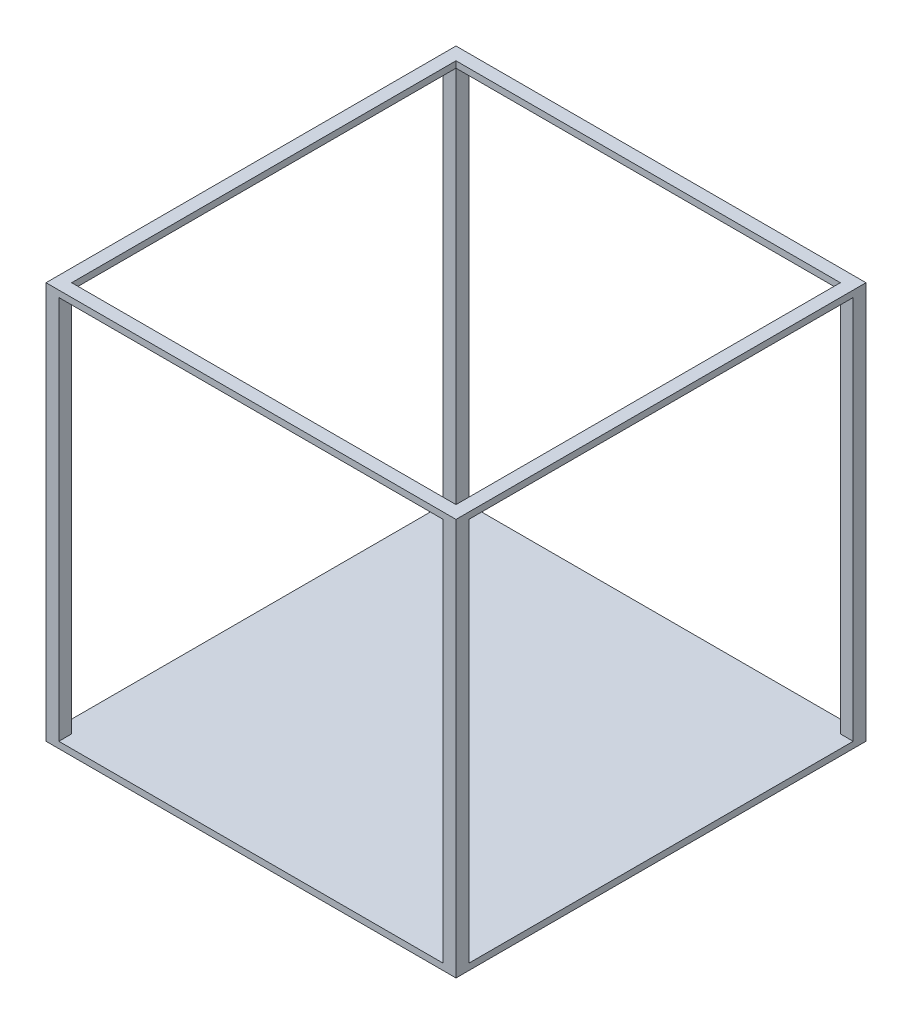
from build123d import *

# Parameters (mm, degrees)
SKETCH1_W           = 406.4
SKETCH1_H           = 406.4
BOSS_EXTRUDE1_DEPTH = 6.35
SKETCH2_W           = 12.7
SKETCH2_H           = 12.7
BOSS_EXTRUDE2_DEPTH = 381
SKETCH3_W           = 406.4
SKETCH3_H           = 406.4
SKETCH3_W_2         = 381
SKETCH3_H_2         = 381
BOSS_EXTRUDE3_DEPTH = 6.35


with BuildPart() as part:
    # Sketch1 → Boss-Extrude1 (new body)
    with BuildSketch(Plane(origin=(0, 0, 0), x_dir=(1, 0, 0), z_dir=(0, 1, 0))):
        Rectangle(SKETCH1_W, SKETCH1_H)
    extrude(amount=BOSS_EXTRUDE1_DEPTH)

    # Sketch2 → Boss-Extrude2 (add)
    with BuildSketch(Plane(origin=(0, 6.35, 0), x_dir=(1, 0, 0), z_dir=(0, 1, 0))):
        with Locations((-196.85, 196.85)):
            Rectangle(SKETCH2_W, SKETCH2_H)
        with Locations((196.85, 196.85)):
            Rectangle(SKETCH2_W, SKETCH2_H)
        with Locations((196.85, -196.85)):
            Rectangle(SKETCH2_W, SKETCH2_H)
        with Locations((-196.85, -196.85)):
            Rectangle(SKETCH2_W, SKETCH2_H)
    extrude(amount=BOSS_EXTRUDE2_DEPTH)

    # Sketch3 → Boss-Extrude3 (add)
    with BuildSketch(Plane(origin=(0, 387.35, 0), x_dir=(1, 0, 0), z_dir=(0, 1, 0))):
        Rectangle(SKETCH3_W, SKETCH3_H)
        Rectangle(SKETCH3_W_2, SKETCH3_H_2, mode=Mode.SUBTRACT)
    extrude(amount=BOSS_EXTRUDE3_DEPTH)


solid = part.part
